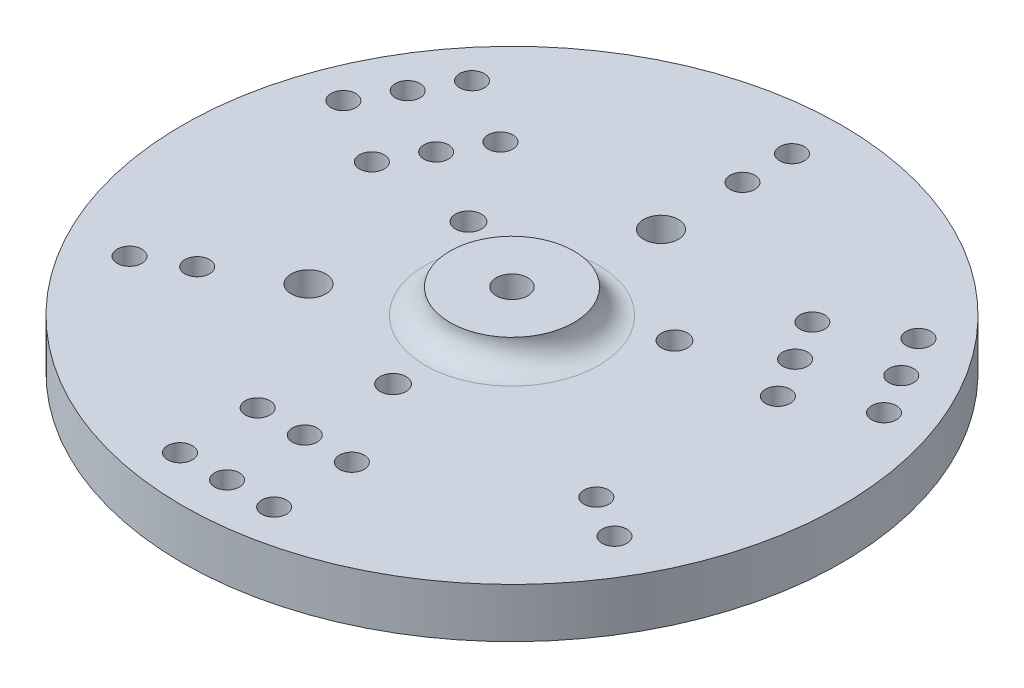
from build123d import *

# Parameters (mm, degrees)
BOSS_EXTRUDE7_DEPTH = 10
SKETCH1_23_R        = 65.000000017
SKETCH1_23_R_2      = 4.125
BOSS_EXTRUDE8_DEPTH = 10
CUT_EXTRUDE1_START  = 65
SKETCH16_R          = 2.5
CUT_EXTRUDE1_DEPTH  = 20
BOSS_EXTRUDE9_START = -0.5
SKETCH17_R          = 12.5
SKETCH17_R_2        = 3.175
BOSS_EXTRUDE9_DEPTH = 5.5
FILLET1_R           = 5
SKETCH18_R          = 2.5
SKETCH18_R_2        = 3.5
CUT_EXTRUDE2_DEPTH  = 10
SKETCH20_R          = 2.625
CUT_EXTRUDE11_DEPTH = 25


with BuildPart() as part:
    # Sketch1 → Boss-Extrude7 (new body)
    with BuildSketch(Plane(origin=(0, 0, 0), x_dir=(1, 0, 0), z_dir=(0, 1, 0))):
        with BuildLine():
            ThreePointArc((-10.099280768, -64.210626285), (-56.291651246, -32.5), (-60.65767394, 23.359079438))
            Line((-60.65767394, 23.359079438), (-64.257390064, 17.124188218))
            ThreePointArc((-64.257390064, 17.124188218), (-57.590689352, -33.25), (-17.298713017, -64.210626285))
            Line((-17.298713017, -64.210626285), (-10.099280768, -64.210626285))
        make_face()
        with BuildLine():
            Line((-64.257390064, 17.124188218), (-60.65767394, 23.359079438))
            ThreePointArc((-60.65767394, 23.359079438), (-60.639599413, 23.405960416), (-60.621488653, 23.452827409))
            Line((-60.621488653, 23.452827409), (-61.93581913, 24.211656463))
            ThreePointArc((-61.93581913, 24.211656463), (-63.196040724, 20.700493636), (-64.257390064, 17.124188218))
        make_face()
        with BuildLine():
            ThreePointArc((-60.621488653, 23.452827409), (-59.667920988, 25.782536821), (-58.624860802, 28.073576473))
            ThreePointArc((-58.624860802, 28.073576473), (-54.991019149, 34.65527107), (-50.621488653, 40.773335485))
            Line((-50.621488653, 40.773335485), (-51.93581913, 41.532164539))
            ThreePointArc((-51.93581913, 41.532164539), (-57.590689352, 33.25), (-61.93581913, 24.211656463))
            Line((-61.93581913, 24.211656463), (-60.621488653, 23.452827409))
        make_face()
        with BuildLine():
            ThreePointArc((-50.621488653, 40.773335485), (-50.589956027, 40.812453359), (-50.558393172, 40.851546848))
            Line((-50.558393172, 40.851546848), (-46.958677048, 47.086438068))
            ThreePointArc((-46.958677048, 47.086438068), (-49.525173722, 44.379129868), (-51.93581913, 41.532164539))
            Line((-51.93581913, 41.532164539), (-50.621488653, 40.773335485))
        make_face()
        with BuildLine():
            Line((-46.958677048, 47.086438068), (-50.558393172, 40.851546848))
            ThreePointArc((-50.558393172, 40.851546848), (0, 65), (50.558393172, 40.851546848))
            Line((50.558393172, 40.851546848), (46.958677048, 47.086438068))
            ThreePointArc((46.958677048, 47.086438068), (0, 66.5), (-46.958677048, 47.086438068))
        make_face()
        with BuildLine():
            Line((46.958677048, 47.086438068), (50.558393172, 40.851546848))
            ThreePointArc((50.558393172, 40.851546848), (50.589956027, 40.812453359), (50.621488653, 40.773335485))
            Line((50.621488653, 40.773335485), (51.93581913, 41.532164539))
            ThreePointArc((51.93581913, 41.532164539), (49.525173722, 44.379129868), (46.958677048, 47.086438068))
        make_face()
        with BuildLine():
            Line((51.93581913, 41.532164539), (50.621488653, 40.773335485))
            ThreePointArc((50.621488653, 40.773335485), (52.162292355, 38.782666956), (53.624860802, 36.733830511))
            ThreePointArc((53.624860802, 36.733830511), (57.507854696, 30.295984028), (60.621488653, 23.452827409))
            Line((60.621488653, 23.452827409), (61.93581913, 24.211656463))
            ThreePointArc((61.93581913, 24.211656463), (57.590689352, 33.25), (51.93581913, 41.532164539))
        make_face()
        with BuildLine():
            ThreePointArc((64.257390064, 17.124188218), (63.196040724, 20.700493636), (61.93581913, 24.211656463))
            Line((61.93581913, 24.211656463), (60.621488653, 23.452827409))
            ThreePointArc((60.621488653, 23.452827409), (60.639599413, 23.405960416), (60.65767394, 23.359079438))
            Line((60.65767394, 23.359079438), (64.257390064, 17.124188218))
        make_face()
        with BuildLine():
            ThreePointArc((66.5, 0), (65.936963986, 8.635205867), (64.257390064, 17.124188218))
            Line((64.257390064, 17.124188218), (60.65767394, 23.359079438))
            ThreePointArc((60.65767394, 23.359079438), (63.90519856, 11.879629495), (65, 0))
            ThreePointArc((65, 0), (49.40371064, -42.240660211), (10.099280768, -64.210626285))
            Line((10.099280768, -64.210626285), (17.298713017, -64.210626285))
            ThreePointArc((17.298713017, -64.210626285), (52.785482927, -40.44678964), (66.5, 0))
        make_face()
        with BuildLine():
            ThreePointArc((-10, -64.226162893), (-10.049643386, -64.218413775), (-10.099280768, -64.210626285))
            Line((-10.099280768, -64.210626285), (-17.298713017, -64.210626285))
            ThreePointArc((-17.298713017, -64.210626285), (-13.670867002, -65.079623504), (-10, -65.743821002))
            Line((-10, -65.743821002), (-10, -64.226162893))
        make_face()
        with BuildLine():
            ThreePointArc((5, -64.807406984), (-2.516835548, -64.951255098), (-10, -64.226162893))
            Line((-10, -64.226162893), (-10, -65.743821002))
            ThreePointArc((-10, -65.743821002), (0, -66.5), (10, -65.743821002))
            Line((10, -65.743821002), (10, -64.226162893))
            ThreePointArc((10, -64.226162893), (7.505628633, -64.565203777), (5, -64.807406984))
        make_face()
        with BuildLine():
            Line((10, -64.226162893), (10, -65.743821002))
            ThreePointArc((10, -65.743821002), (13.670867002, -65.079623504), (17.298713017, -64.210626285))
            Line((17.298713017, -64.210626285), (10.099280768, -64.210626285))
            ThreePointArc((10.099280768, -64.210626285), (10.049643386, -64.218413775), (10, -64.226162893))
        make_face()
    extrude(amount=BOSS_EXTRUDE7_DEPTH)

    # Sketch1<23> → Boss-Extrude8 (add)
    with BuildSketch(Plane(origin=(0, 0, 0), x_dir=(1, 0, 0), z_dir=(0, 1, 0))):
        with Locations((-3e-09, 1.7e-08)):
            Circle(SKETCH1_23_R)
        with Locations(Location((0, 0, 0), (0, 0, 270))):
            Circle(SKETCH1_23_R_2, mode=Mode.SUBTRACT)
    extrude(amount=BOSS_EXTRUDE8_DEPTH)

    # Sketch16 → Cut-Extrude1 (cut)
    with BuildSketch(Plane.XZ.offset(-75).offset(CUT_EXTRUDE1_START)):
        with Locations(Location((36.217182386, -20.91, 0), (0, 0, 90))):
            Circle(SKETCH16_R)
        with Locations(Location((49.796460718, -28.75, 0), (0, 0, 90))):
            Circle(SKETCH16_R)
        with Locations(Location((-40.967182386, -12.682758664, 0), (0, 0, 90))):
            Circle(SKETCH16_R)
        with Locations(Location((-36.217182386, -20.91, 0), (0, 0, 90))):
            Circle(SKETCH16_R)
        with Locations(Location((-49.796460718, -28.75, 0), (0, 0, 90))):
            Circle(SKETCH16_R)
        with Locations(Location((0, 41.82, 0), (0, 0, 90))):
            Circle(SKETCH16_R)
        with Locations(Location((0, 57.5, 0), (0, 0, 90))):
            Circle(SKETCH16_R)
        with Locations(Location((-31.467182386, -29.137241336, 0), (0, 0, 90))):
            Circle(SKETCH16_R)
        with Locations(Location((-45.046460718, -36.977241336, 0), (0, 0, 90))):
            Circle(SKETCH16_R)
        with Locations(Location((-54.546460718, -20.522758664, 0), (0, 0, 90))):
            Circle(SKETCH16_R)
        with Locations(Location((9.5, 41.82, 0), (0, 0, 90))):
            Circle(SKETCH16_R)
        with Locations(Location((-9.5, 41.82, 0), (0, 0, 90))):
            Circle(SKETCH16_R)
        with Locations(Location((-9.5, 57.5, 0), (0, 0, 90))):
            Circle(SKETCH16_R)
        with Locations(Location((9.5, 57.5, 0), (0, 0, 90))):
            Circle(SKETCH16_R)
        with Locations(Location((31.467182386, -29.137241336, 0), (0, 0, 90))):
            Circle(SKETCH16_R)
        with Locations(Location((40.967182386, -12.682758664, 0), (0, 0, 90))):
            Circle(SKETCH16_R)
        with Locations(Location((54.546460718, -20.522758664, 0), (0, 0, 90))):
            Circle(SKETCH16_R)
        with Locations(Location((45.046460718, -36.977241336, 0), (0, 0, 90))):
            Circle(SKETCH16_R)
    extrude(amount=CUT_EXTRUDE1_DEPTH, mode=Mode.SUBTRACT)

    # Sketch17 → Boss-Extrude9 (add)
    with BuildSketch(Plane(origin=(0, 10, 0), x_dir=(1, 0, 0), z_dir=(0, 1, 0)).offset(BOSS_EXTRUDE9_START)):
        with Locations(Location((0, 0, 0), (0, 0, 270))):
            Circle(SKETCH17_R)
        with Locations(Location((0, 0, 0), (0, 0, 270))):
            Circle(SKETCH17_R_2, mode=Mode.SUBTRACT)
    extrude(amount=BOSS_EXTRUDE9_DEPTH)

    # Fillet1
    fillet1_edges = [part.edges().sort_by_distance(p)[0] for p in [
        (0, 10, -12.5),
    ]]
    fillet(fillet1_edges, radius=FILLET1_R - 0.0001)  # a hair under: the kernel refuses the full size

    # Sketch18 → Cut-Extrude2 (cut)
    with BuildSketch(Plane(origin=(0, 10, 0), x_dir=(1, 0, 0), z_dir=(0, 1, 0))):
        with Locations(Location((0, 56.5, 0), (0, 0, 270))):
            Circle(SKETCH18_R)
        with Locations(Location((0, 46.5, 0), (0, 0, 270))):
            Circle(SKETCH18_R)
        with Locations(Location((40.270181276, -23.25, 0), (0, 0, 270))):
            Circle(SKETCH18_R)
        with Locations(Location((48.930435314, -28.25, 0), (0, 0, 270))):
            Circle(SKETCH18_R)
        with Locations(Location((-40.270181276, -23.25, 0), (0, 0, 270))):
            Circle(SKETCH18_R)
        with Locations(Location((-48.930435314, -28.25, 0), (0, 0, 270))):
            Circle(SKETCH18_R)
        with Locations(Location((-26.035163591, -15.031408708, 0), (0, 0, 270))):
            Circle(SKETCH18_R_2)
        with Locations(Location((0, 30.062817415, 0), (0, 0, 270))):
            Circle(SKETCH18_R_2)
    extrude(amount=-CUT_EXTRUDE2_DEPTH, mode=Mode.SUBTRACT)

    # Sketch20 → Cut-Extrude11 (cut)
    with BuildSketch(Plane(origin=(0, 10, 0), x_dir=(1, 0, 0), z_dir=(0, 1, 0))):
        with Locations(Location((-20.784609691, 12, 0), (0, 0, 270))):
            Circle(SKETCH20_R)
        with Locations(Location((0, -24, 0), (0, 0, 270))):
            Circle(SKETCH20_R)
        with Locations(Location((20.784609691, 12, 0), (0, 0, 270))):
            Circle(SKETCH20_R)
    extrude(amount=-CUT_EXTRUDE11_DEPTH, mode=Mode.SUBTRACT)


solid = part.part
